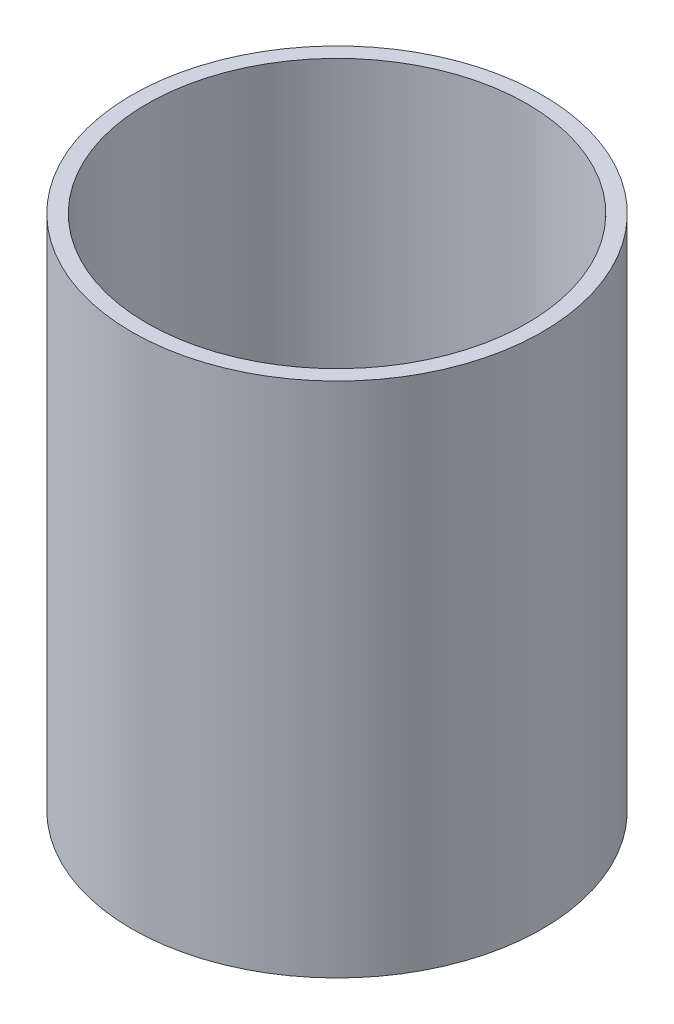
from build123d import *

# Parameters (mm, degrees)
SKETCH1_W = 3.175
SKETCH1_H = 107.95


with BuildPart() as part:
    # Sketch1 → Revolve1 (revolve)
    with BuildSketch(Plane.XY):
        with Locations((-41.275, -16.995896605)):
            Rectangle(SKETCH1_W, SKETCH1_H)
    revolve(axis=Axis((0, 55, 0), (0, -1, 0)))


solid = part.part
